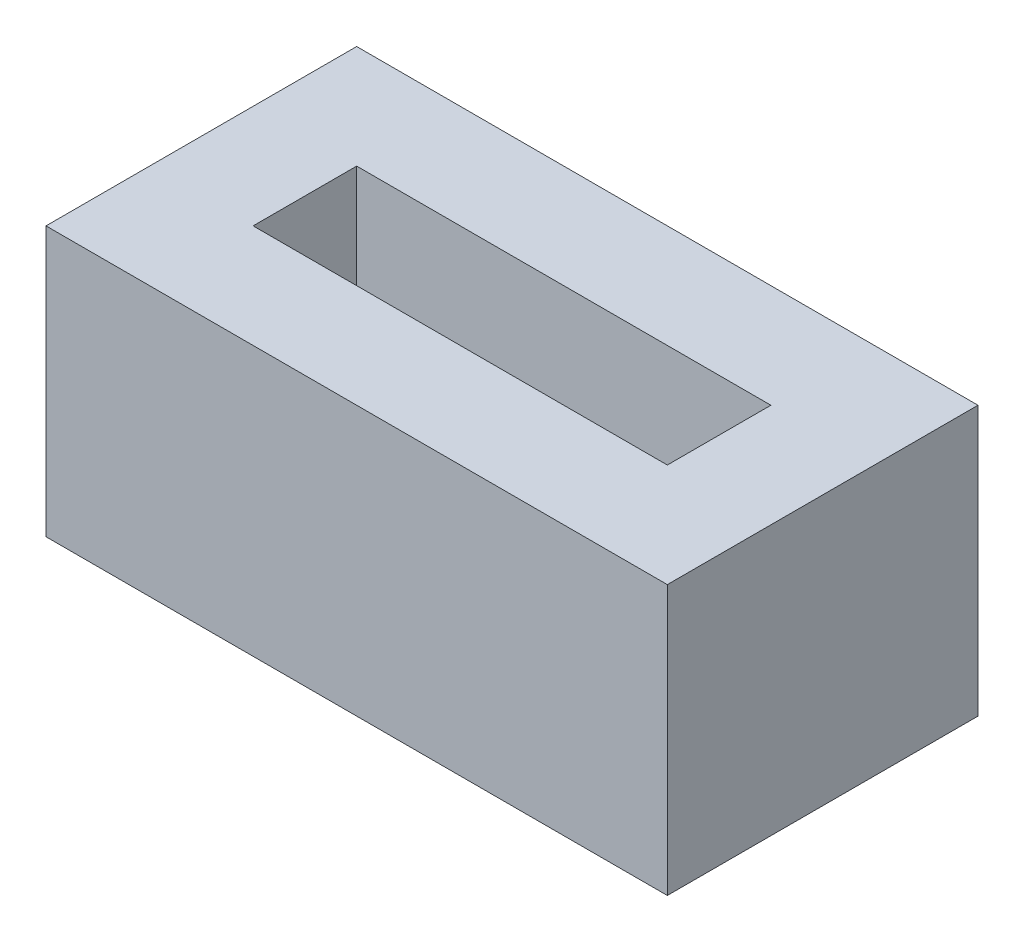
from build123d import *

# Parameters (mm, degrees)
SKETCH1_W           = 38.1
SKETCH1_H           = 19.05
BOSS_EXTRUDE1_DEPTH = 16.51
SKETCH2_W           = 25.4
SKETCH2_H           = 6.35
CUT_EXTRUDE1_DEPTH  = 12.7


with BuildPart() as part:
    # Sketch1 → Boss-Extrude1 (new body)
    with BuildSketch(Plane(origin=(0, 0, 0), x_dir=(1, 0, 0), z_dir=(0, 1, 0))):
        Rectangle(SKETCH1_W, SKETCH1_H)
    extrude(amount=BOSS_EXTRUDE1_DEPTH)

    # Sketch2 → Cut-Extrude1 (cut)
    with BuildSketch(Plane(origin=(0, 16.51, 0), x_dir=(1, 0, 0), z_dir=(0, 1, 0))):
        Rectangle(SKETCH2_W, SKETCH2_H)
    extrude(amount=-CUT_EXTRUDE1_DEPTH, mode=Mode.SUBTRACT)


solid = part.part
